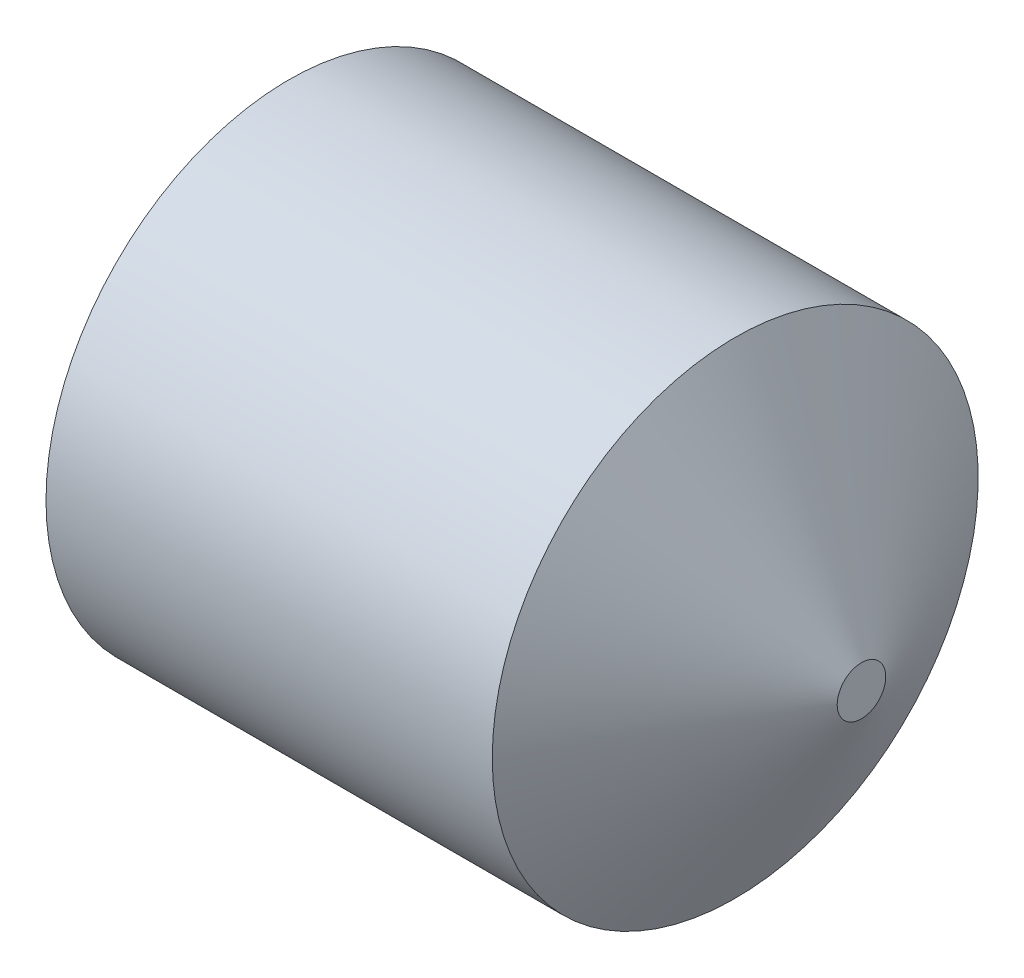
from build123d import *

# Parameters (mm, degrees)
HEXAGONSOCKET_DEPTH = 0.7


with BuildPart() as part:
    # BodySke → BaseBody (revolve)
    with BuildSketch(Plane.XY):
        Polygon((2, 0), (2, 0.08), (1.584307806, 0.8), (0, 0.8), (0, 0), align=None)
    revolve(axis=Axis((0, 0, 0), (1, 0, 0)))

    # HeadChamferSke → HeadChamfer (revolve, cut)
    with BuildSketch(Plane.XY):
        Polygon((0, 0.8), (0, 0.601), (0.114892704, 0.8), align=None)
    revolve(axis=Axis((0, 0, 0), (1, 0, 0)), mode=Mode.SUBTRACT)

    # HexagonSocketSke → HexagonSocket (cut)
    with BuildSketch(Plane.ZY):
        Polygon((0, 0.404145188), (-0.35, 0.202072594), (-0.35, -0.202072594), (0, -0.404145188), (0.35, -0.202072594), (0.35, 0.202072594), align=None)
    extrude(amount=-HEXAGONSOCKET_DEPTH, mode=Mode.SUBTRACT)


solid = part.part
